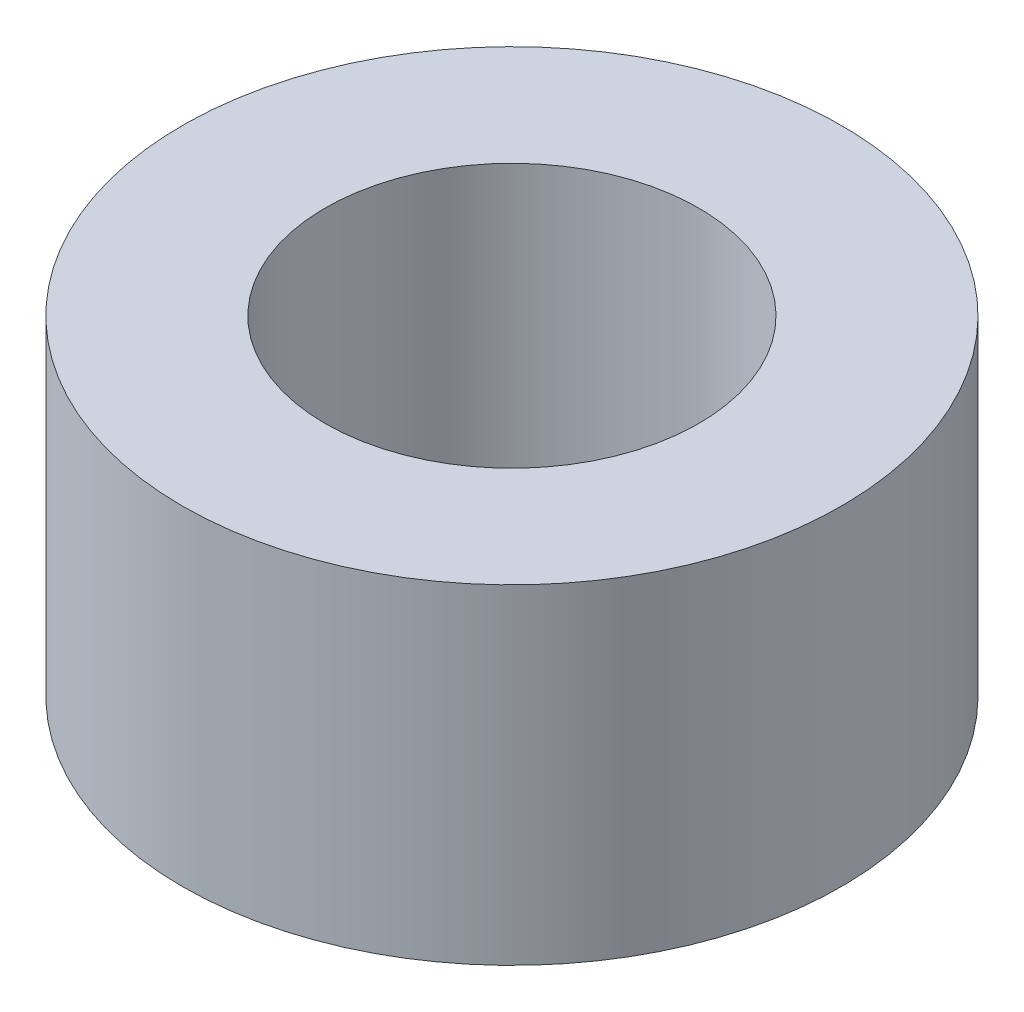
from build123d import *

# Parameters (mm, degrees)
SKETCH1_R           = 3
SKETCH1_R_2         = 1.7
BOSS_EXTRUDE1_DEPTH = 3


with BuildPart() as part:
    # Sketch1 → Boss-Extrude1 (new body)
    with BuildSketch(Plane(origin=(0, 0, 0), x_dir=(1, 0, 0), z_dir=(0, 1, 0))):
        Circle(SKETCH1_R)
        Circle(SKETCH1_R_2, mode=Mode.SUBTRACT)
    extrude(amount=BOSS_EXTRUDE1_DEPTH)


solid = part.part
